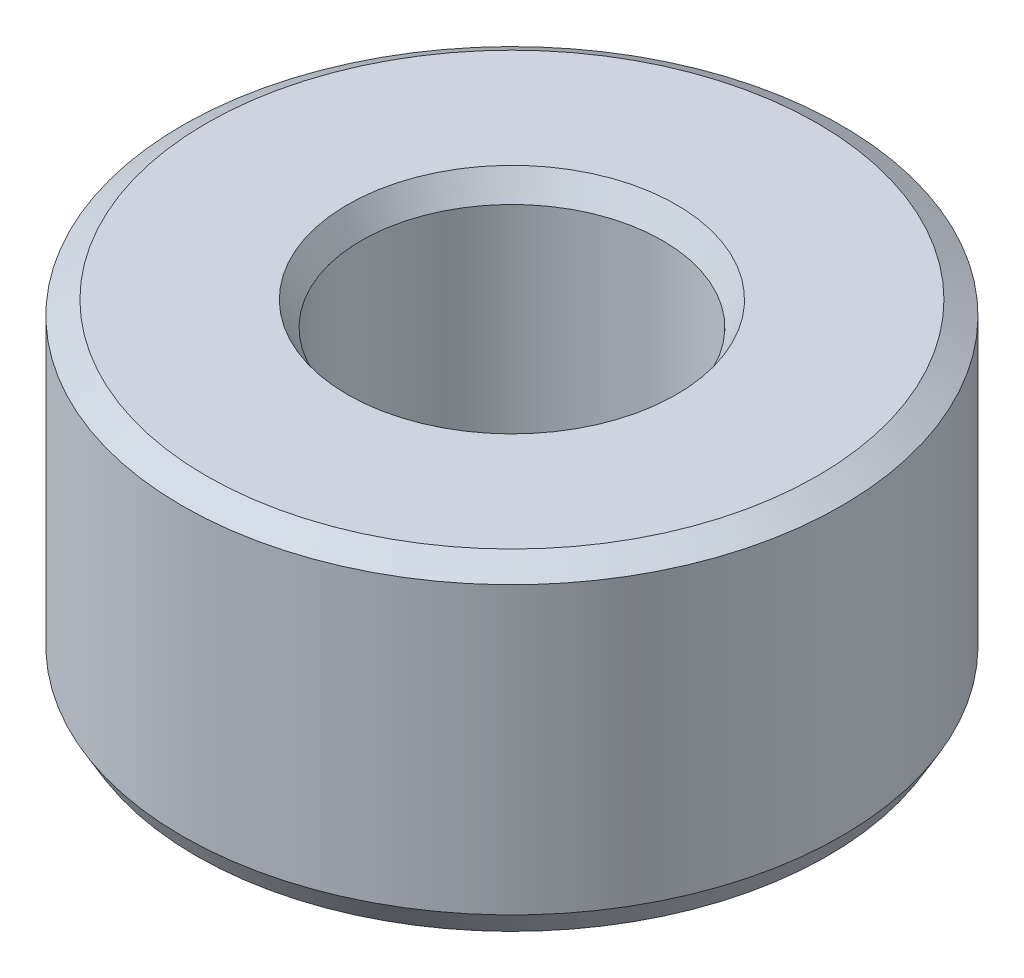
from build123d import *
from OCP.BRepFilletAPI import BRepFilletAPI_MakeChamfer

# Parameters (mm, degrees)
SKETCH1_R           = 10
BOSS_EXTRUDE1_DEPTH = 9.829285127
SKETCH2_R           = 4.569402563
CUT_EXTRUDE1_DEPTH  = 18.222509867
CHAMFER1_SIZE       = 0.421712562
CHAMFER1_SIZE2      = 0.730427584


with BuildPart() as part:
    # Sketch1 → Boss-Extrude1 (new body)
    with BuildSketch(Plane(origin=(0, 0, 0), x_dir=(1, 0, 0), z_dir=(0, 1, 0))):
        Circle(SKETCH1_R)
    extrude(amount=BOSS_EXTRUDE1_DEPTH)

    # Sketch2 → Cut-Extrude1 (cut, through all)
    with BuildSketch(Plane(origin=(0, 0, 0), x_dir=(1, 0, 0), z_dir=(0, 1, 0))):
        Circle(SKETCH2_R)
    extrude(amount=CUT_EXTRUDE1_DEPTH, mode=Mode.SUBTRACT)

    # Chamfer1: one chamfer whose edges measure the first distance from different faces: ONE call of the kernel's chamfer builder (chamfer() names one face for all edges)
    chamfer1_edges_1 = [part.edges().sort_by_distance(p)[0] for p in [
        (-4.569402563, 9.829285127, 0),
    ]]
    chamfer1_side_1 = [part.faces().sort_by_distance(p)[0] for p in [
        (-9.717157288, 9.829285127, 0),
    ]]
    chamfer1_edges_2 = [part.edges().sort_by_distance(p)[0] for p in [
        (-4.569402563, 0, 0),
    ]]
    chamfer1_side_2 = [part.faces().sort_by_distance(p)[0] for p in [
        (-4.569402563, 4.914642564, 0),
    ]]
    chamfer1_edges_3 = [part.edges().sort_by_distance(p)[0] for p in [
        (-10, 0, 0),
    ]]
    chamfer1_side_3 = [part.faces().sort_by_distance(p)[0] for p in [
        (-9.717157288, 0, 0),
    ]]
    chamfer1_edges_4 = [part.edges().sort_by_distance(p)[0] for p in [
        (-10, 9.829285127, 0),
    ]]
    chamfer1_side_4 = [part.faces().sort_by_distance(p)[0] for p in [
        (-10, 4.914642564, 0),
    ]]
    chamfer1 = BRepFilletAPI_MakeChamfer(part.part.solid().wrapped)
    for e in chamfer1_edges_1:
        chamfer1.Add(CHAMFER1_SIZE, CHAMFER1_SIZE2, e.wrapped, chamfer1_side_1[0].wrapped)  # the first distance lies on this face
    for e in chamfer1_edges_2:
        chamfer1.Add(CHAMFER1_SIZE, CHAMFER1_SIZE2, e.wrapped, chamfer1_side_2[0].wrapped)  # the first distance lies on this face
    for e in chamfer1_edges_3:
        chamfer1.Add(CHAMFER1_SIZE, CHAMFER1_SIZE2, e.wrapped, chamfer1_side_3[0].wrapped)  # the first distance lies on this face
    for e in chamfer1_edges_4:
        chamfer1.Add(CHAMFER1_SIZE, CHAMFER1_SIZE2, e.wrapped, chamfer1_side_4[0].wrapped)  # the first distance lies on this face
    add(Compound.cast(chamfer1.Shape()), mode=Mode.REPLACE)


solid = part.part
